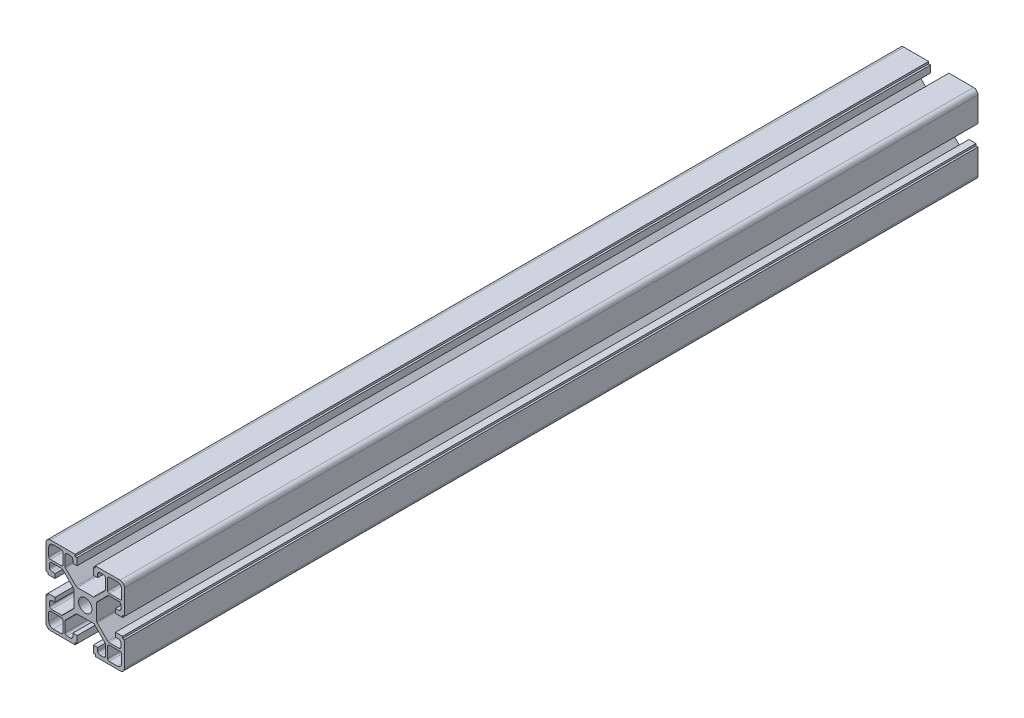
from build123d import *

# Parameters (mm, degrees)
SKETCH1_R           = 3.4
BOSS_EXTRUDE1_DEPTH = 713
SKETCH2_W           = 40
SKETCH2_H           = 278
CUT_EXTRUDE1_DEPTH  = 715.401147815


with BuildPart() as part:
    # Sketch1 → Boss-Extrude1 (new body)
    with BuildSketch(Plane.XY):
        with BuildLine():
            Line((20, 17.75), (20, 5.15))
            Line((20, 5.15), (19, 5.15))
            Line((19, 5.15), (19, 4.15))
            Line((19, 4.15), (15.4, 4.15))
            Line((15.4, 4.15), (15.4, 6.35))
            Line((15.4, 6.35), (16.95, 6.35))
            ThreePointArc((16.95, 6.35), (17.833883476, 6.716116524), (18.2, 7.6))
            Line((18.2, 7.6), (18.2, 9.3))
            ThreePointArc((18.2, 9.3), (17.907106781, 10.007106781), (17.2, 10.3))
            Line((17.2, 10.3), (12.03669957, 10.3))
            ThreePointArc((12.03669957, 10.3), (11.73040037, 10.239040459), (11.470780817, 10.065452001))
            Line((11.470780817, 10.065452001), (6.084081247, 4.674305984))
            ThreePointArc((6.084081247, 4.674305984), (5.910833239, 4.414848262), (5.85, 4.108853983))
            Line((5.85, 4.108853983), (5.85, -4.108853983))
            ThreePointArc((5.85, -4.108853983), (5.910833239, -4.414848262), (6.084081247, -4.674305984))
            Line((6.084081247, -4.674305984), (11.470780817, -10.065452001))
            ThreePointArc((11.470780817, -10.065452001), (11.73040037, -10.239040459), (12.03669957, -10.3))
            Line((12.03669957, -10.3), (17.2, -10.3))
            ThreePointArc((17.2, -10.3), (17.907106781, -10.007106781), (18.2, -9.3))
            Line((18.2, -9.3), (18.2, -7.6))
            ThreePointArc((18.2, -7.6), (17.833883476, -6.716116524), (16.95, -6.35))
            Line((16.95, -6.35), (15.4, -6.35))
            Line((15.4, -6.35), (15.4, -4.15))
            Line((15.4, -4.15), (19, -4.15))
            Line((19, -4.15), (19, -5.15))
            Line((19, -5.15), (20, -5.15))
            Line((20, -5.15), (20, -17.75))
            ThreePointArc((20, -17.75), (19.340990258, -19.340990258), (17.75, -20))
            Line((17.75, -20), (5.15, -20))
            Line((5.15, -20), (5.15, -19))
            Line((5.15, -19), (4.15, -19))
            Line((4.15, -19), (4.15, -15.4))
            Line((4.15, -15.4), (6.35, -15.4))
            Line((6.35, -15.4), (6.35, -16.95))
            ThreePointArc((6.35, -16.95), (6.716116524, -17.833883476), (7.6, -18.2))
            Line((7.6, -18.2), (9.3, -18.2))
            ThreePointArc((9.3, -18.2), (10.007106781, -17.907106781), (10.3, -17.2))
            Line((10.3, -17.2), (10.3, -12.054477022))
            ThreePointArc((10.3, -12.054477022), (10.239166761, -11.748482743), (10.065918753, -11.489025021))
            Line((10.065918753, -11.489025021), (4.665899173, -6.084547999))
            ThreePointArc((4.665899173, -6.084547999), (4.406279619, -5.910959541), (4.09998042, -5.85))
            Line((4.09998042, -5.85), (-4.09998042, -5.85))
            ThreePointArc((-4.09998042, -5.85), (-4.406279619, -5.910959541), (-4.665899173, -6.084547999))
            Line((-4.665899173, -6.084547999), (-10.065918753, -11.489025021))
            ThreePointArc((-10.065918753, -11.489025021), (-10.239166761, -11.748482743), (-10.3, -12.054477022))
            Line((-10.3, -12.054477022), (-10.3, -17.2))
            ThreePointArc((-10.3, -17.2), (-10.007106781, -17.907106781), (-9.3, -18.2))
            Line((-9.3, -18.2), (-7.6, -18.2))
            ThreePointArc((-7.6, -18.2), (-6.716116524, -17.833883476), (-6.35, -16.95))
            Line((-6.35, -16.95), (-6.35, -15.4))
            Line((-6.35, -15.4), (-4.15, -15.4))
            Line((-4.15, -15.4), (-4.15, -19))
            Line((-4.15, -19), (-5.15, -19))
            Line((-5.15, -19), (-5.15, -20))
            Line((-5.15, -20), (-17.75, -20))
            ThreePointArc((-17.75, -20), (-19.340990258, -19.340990258), (-20, -17.75))
            Line((-20, -17.75), (-20, -5.15))
            Line((-20, -5.15), (-19, -5.15))
            Line((-19, -5.15), (-19, -4.15))
            Line((-19, -4.15), (-15.4, -4.15))
            Line((-15.4, -4.15), (-15.4, -6.35))
            Line((-15.4, -6.35), (-16.95, -6.35))
            ThreePointArc((-16.95, -6.35), (-17.833883476, -6.716116524), (-18.2, -7.6))
            Line((-18.2, -7.6), (-18.2, -9.3))
            ThreePointArc((-18.2, -9.3), (-17.907106781, -10.007106781), (-17.2, -10.3))
            Line((-17.2, -10.3), (-12.03669957, -10.3))
            ThreePointArc((-12.03669957, -10.3), (-11.73040037, -10.239040459), (-11.470780817, -10.065452001))
            Line((-11.470780817, -10.065452001), (-6.084081247, -4.674305984))
            ThreePointArc((-6.084081247, -4.674305984), (-5.910833239, -4.414848262), (-5.85, -4.108853983))
            Line((-5.85, -4.108853983), (-5.85, 4.108853983))
            ThreePointArc((-5.85, 4.108853983), (-5.910833239, 4.414848262), (-6.084081247, 4.674305984))
            Line((-6.084081247, 4.674305984), (-11.470780817, 10.065452001))
            ThreePointArc((-11.470780817, 10.065452001), (-11.73040037, 10.239040459), (-12.03669957, 10.3))
            Line((-12.03669957, 10.3), (-17.2, 10.3))
            ThreePointArc((-17.2, 10.3), (-17.907106781, 10.007106781), (-18.2, 9.3))
            Line((-18.2, 9.3), (-18.2, 7.6))
            ThreePointArc((-18.2, 7.6), (-17.833883476, 6.716116524), (-16.95, 6.35))
            Line((-16.95, 6.35), (-15.4, 6.35))
            Line((-15.4, 6.35), (-15.4, 4.15))
            Line((-15.4, 4.15), (-19, 4.15))
            Line((-19, 4.15), (-19, 5.15))
            Line((-19, 5.15), (-20, 5.15))
            Line((-20, 5.15), (-20, 17.75))
            ThreePointArc((-20, 17.75), (-19.340990258, 19.340990258), (-17.75, 20))
            Line((-17.75, 20), (-5.15, 20))
            Line((-5.15, 20), (-5.15, 19))
            Line((-5.15, 19), (-4.15, 19))
            Line((-4.15, 19), (-4.15, 15.4))
            Line((-4.15, 15.4), (-6.35, 15.4))
            Line((-6.35, 15.4), (-6.35, 16.95))
            ThreePointArc((-6.35, 16.95), (-6.716116524, 17.833883476), (-7.6, 18.2))
            Line((-7.6, 18.2), (-9.3, 18.2))
            ThreePointArc((-9.3, 18.2), (-10.007106781, 17.907106781), (-10.3, 17.2))
            Line((-10.3, 17.2), (-10.3, 12.054477022))
            ThreePointArc((-10.3, 12.054477022), (-10.239166761, 11.748482743), (-10.065918753, 11.489025021))
            Line((-10.065918753, 11.489025021), (-4.665899173, 6.084547999))
            ThreePointArc((-4.665899173, 6.084547999), (-4.406279619, 5.910959541), (-4.09998042, 5.85))
            Line((-4.09998042, 5.85), (4.09998042, 5.85))
            ThreePointArc((4.09998042, 5.85), (4.406279619, 5.910959541), (4.665899173, 6.084547999))
            Line((4.665899173, 6.084547999), (10.065918753, 11.489025021))
            ThreePointArc((10.065918753, 11.489025021), (10.239166761, 11.748482743), (10.3, 12.054477022))
            Line((10.3, 12.054477022), (10.3, 17.2))
            ThreePointArc((10.3, 17.2), (10.007106781, 17.907106781), (9.3, 18.2))
            Line((9.3, 18.2), (7.6, 18.2))
            ThreePointArc((7.6, 18.2), (6.716116524, 17.833883476), (6.35, 16.95))
            Line((6.35, 16.95), (6.35, 15.4))
            Line((6.35, 15.4), (4.15, 15.4))
            Line((4.15, 15.4), (4.15, 19))
            Line((4.15, 19), (5.15, 19))
            Line((5.15, 19), (5.15, 20))
            Line((5.15, 20), (17.75, 20))
            ThreePointArc((17.75, 20), (19.340990258, 19.340990258), (20, 17.75))
        make_face()
        Circle(SKETCH1_R, mode=Mode.SUBTRACT)
        with BuildLine():
            Line((18.6, 16.35), (18.6, 12.2))
            ThreePointArc((18.6, 12.2), (18.365685425, 11.634314575), (17.8, 11.4))
            Line((17.8, 11.4), (12.2, 11.4))
            ThreePointArc((12.2, 11.4), (11.634314575, 11.634314575), (11.4, 12.2))
            Line((11.4, 12.2), (11.4, 17.8))
            ThreePointArc((11.4, 17.8), (11.634314575, 18.365685425), (12.2, 18.6))
            Line((12.2, 18.6), (16.35, 18.6))
            ThreePointArc((16.35, 18.6), (17.940990258, 17.940990258), (18.6, 16.35))
        make_face(mode=Mode.SUBTRACT)
        with BuildLine():
            Line((-12.2, 18.6), (-16.35, 18.6))
            ThreePointArc((-16.35, 18.6), (-17.940990258, 17.940990258), (-18.6, 16.35))
            Line((-18.6, 16.35), (-18.6, 12.2))
            ThreePointArc((-18.6, 12.2), (-18.365685425, 11.634314575), (-17.8, 11.4))
            Line((-17.8, 11.4), (-12.2, 11.4))
            ThreePointArc((-12.2, 11.4), (-11.634314575, 11.634314575), (-11.4, 12.2))
            Line((-11.4, 12.2), (-11.4, 17.8))
            ThreePointArc((-11.4, 17.8), (-11.634314575, 18.365685425), (-12.2, 18.6))
        make_face(mode=Mode.SUBTRACT)
        with BuildLine():
            Line((-18.6, -16.35), (-18.6, -12.2))
            ThreePointArc((-18.6, -12.2), (-18.365685425, -11.634314575), (-17.8, -11.4))
            Line((-17.8, -11.4), (-12.2, -11.4))
            ThreePointArc((-12.2, -11.4), (-11.634314575, -11.634314575), (-11.4, -12.2))
            Line((-11.4, -12.2), (-11.4, -17.8))
            ThreePointArc((-11.4, -17.8), (-11.634314575, -18.365685425), (-12.2, -18.6))
            Line((-12.2, -18.6), (-16.35, -18.6))
            ThreePointArc((-16.35, -18.6), (-17.940990258, -17.940990258), (-18.6, -16.35))
        make_face(mode=Mode.SUBTRACT)
        with BuildLine():
            Line((12.2, -18.6), (16.35, -18.6))
            ThreePointArc((16.35, -18.6), (17.940990258, -17.940990258), (18.6, -16.35))
            Line((18.6, -16.35), (18.6, -12.2))
            ThreePointArc((18.6, -12.2), (18.365685425, -11.634314575), (17.8, -11.4))
            Line((17.8, -11.4), (12.2, -11.4))
            ThreePointArc((12.2, -11.4), (11.634314575, -11.634314575), (11.4, -12.2))
            Line((11.4, -12.2), (11.4, -17.8))
            ThreePointArc((11.4, -17.8), (11.634314575, -18.365685425), (12.2, -18.6))
        make_face(mode=Mode.SUBTRACT)
    extrude(amount=BOSS_EXTRUDE1_DEPTH)

    # Sketch2 → Cut-Extrude1 (cut, through all)
    with BuildSketch(Plane(origin=(0, 20, 0), x_dir=(1, 0, 0), z_dir=(0, 1, 0))):
        with Locations((0, -574)):
            Rectangle(SKETCH2_W, SKETCH2_H)
    extrude(amount=-CUT_EXTRUDE1_DEPTH, mode=Mode.SUBTRACT)


solid = part.part
